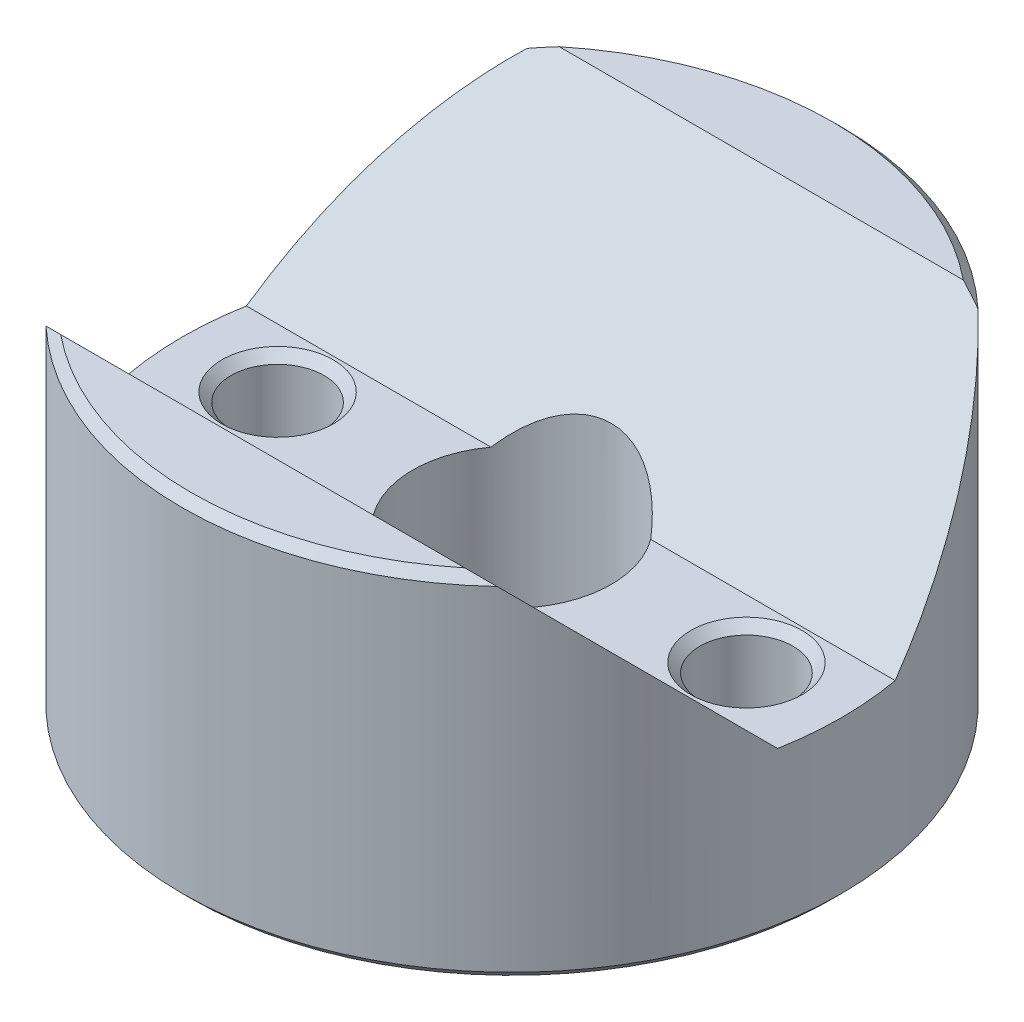
from build123d import *

# Parameters (mm, degrees)
SKETCH1_R                      = 14.2875
EXTRUDE1_DEPTH                 = 15.24
CUT_EXTRUDE1_DEPTH             = 26.308554137
CUT_EXTRUDE1_DEPTH_BACK        = 26.308554137
TAP_DRILL_FOR_10_TAP1_D        = 4.0386
CHAMFER1_SIZE                  = 0.3937
SKETCH6_R                      = 6.35
CUT_EXTRUDE2_DEPTH             = 0.635
CHAMFER2_SIZE                  = 0.635
CHAMFER3_SIZE                  = 0.381
F_8_6_8_6_DIAMETER_HOLE1_D     = 8.6
F_8_6_8_6_DIAMETER_HOLE1_DEPTH = 15.24
F_8_6_8_6_DIAMETER_HOLE1_TIP   = 2.583700662


with BuildPart() as part:
    # Sketch1 → Extrude1 (new body)
    with BuildSketch(Plane(origin=(0, 0, 0), x_dir=(1, 0, 0), z_dir=(0, 1, 0))):
        with Locations(Location((0, 0, 0), (0, 0, 90))):
            Circle(SKETCH1_R)
    extrude(amount=EXTRUDE1_DEPTH)

    # Sketch3 → Cut-Extrude1 (cut, two sides: drawn at the far end of the back side and taken through both)
    with BuildSketch(Plane(origin=(0, 0, 0), x_dir=(0, 0, -1), z_dir=(1, 0, 0)).offset(-CUT_EXTRUDE1_DEPTH_BACK)):
        Polygon((-10.803384182, 15.24), (10.803384182, 15.24), (2.548384182, 6.985), (-2.548384182, 6.985), align=None)
    extrude(amount=CUT_EXTRUDE1_DEPTH + CUT_EXTRUDE1_DEPTH_BACK, mode=Mode.SUBTRACT)

    # Tap Drill for #10 Tap1 (through all)
    with Locations(Plane.XZ):
        with Locations((-10.16, 0), (10.16, 0)):
            Hole(TAP_DRILL_FOR_10_TAP1_D / 2)

    # Chamfer1
    chamfer1_edges = [part.edges().sort_by_distance(p)[0] for p in [
        (12.1793, 6.985, 0),
        (12.1793, 0, 0),
        (-8.1407, 6.985, 0),
        (-8.1407, 0, 0),
    ]]
    chamfer(chamfer1_edges, length=CHAMFER1_SIZE)

    # Sketch6 → Cut-Extrude2 (cut)
    with BuildSketch(Plane.XZ):
        with Locations(Location((0, 0, 0), (0, 0, 270))):
            Circle(SKETCH6_R)
    extrude(amount=-CUT_EXTRUDE2_DEPTH, mode=Mode.SUBTRACT)

    # Chamfer2
    chamfer2_edges = [part.edges().sort_by_distance(p)[0] for p in [
        (0, 0.635, 6.35),
    ]]
    chamfer(chamfer2_edges, length=CHAMFER2_SIZE - 0.0001)  # a hair under: the kernel refuses the full size

    # Sketch9 → Cut-Revolve1 (revolve, cut)
    with BuildSketch(Plane.XY, mode=Mode.PRIVATE) as cut_revolve1_sk:
        Polygon((2.032, 6.985), (1.5875, 6.5405), (1.5875, 0.9525), (1.905, 0.635), (0, 0.635), (0, 6.985), align=None)
    revolve(cut_revolve1_sk.sketch.rotate(Axis((0, 0, 0), (0, 1, 0)), 90), axis=Axis((0, 0, 0), (0, 1, 0)), mode=Mode.SUBTRACT)

    # Chamfer3
    chamfer3_edges = [part.edges().sort_by_distance(p)[0] for p in [
        (0, 0, 14.2875),
        (4.988953034, 15.24, -13.388166561),
        (0, 15.24, 14.2875),
    ]]
    chamfer(chamfer3_edges, length=CHAMFER3_SIZE)

    # Ø8.6 (8.6) Diameter Hole1
    with Locations(Plane.XZ.offset(-0.635)):
        with Locations((0, 0)):
            Hole(F_8_6_8_6_DIAMETER_HOLE1_D / 2, depth=F_8_6_8_6_DIAMETER_HOLE1_DEPTH)
            with Locations((0, 0, -(F_8_6_8_6_DIAMETER_HOLE1_DEPTH + F_8_6_8_6_DIAMETER_HOLE1_TIP / 2))):  # 118° drill point
                Cone(0, F_8_6_8_6_DIAMETER_HOLE1_D / 2, F_8_6_8_6_DIAMETER_HOLE1_TIP, mode=Mode.SUBTRACT)


solid = part.part
